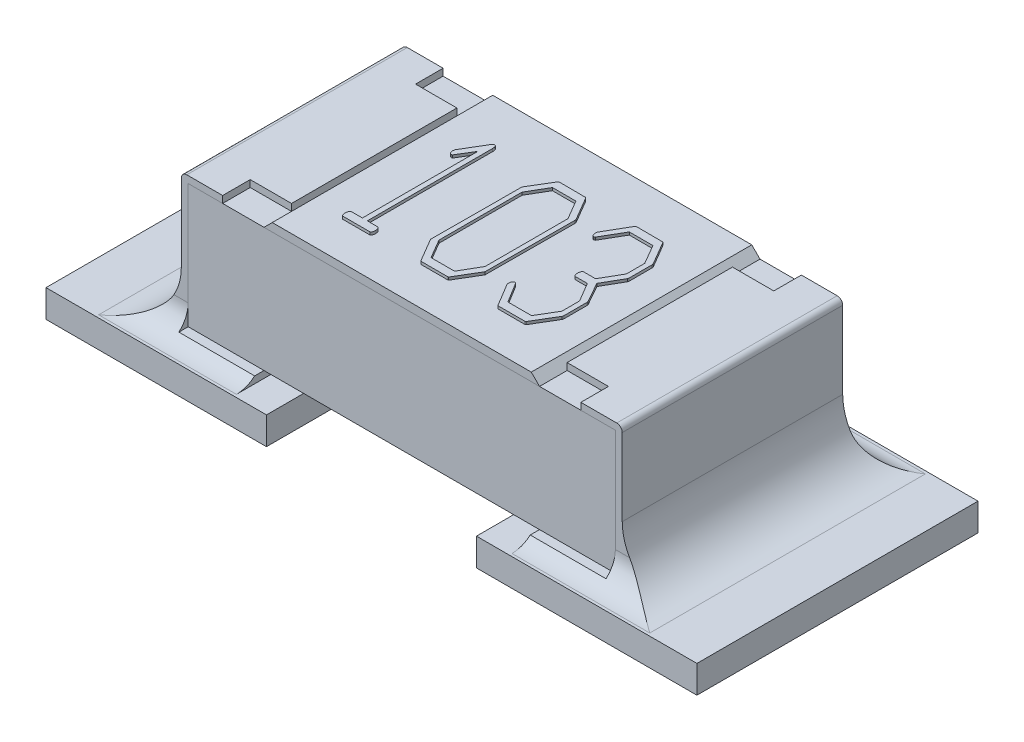
from build123d import *

# Parameters (mm, degrees)
SKETCH1_W             = 0.8
SKETCH1_H             = 0.45
BOSS_EXTRUDE1_DEPTH   = 0.775
BOSS_EXTRUDE2_DEPTH   = 0.4
BOSS_EXTRUDE2_2_DEPTH = 0.4
SKETCH3_W             = 0.15
SKETCH3_H             = 0.1
CUT_EXTRUDE1_DEPTH    = 0.025
BOSS_EXTRUDE3_DEPTH   = 0.4
BOSS_EXTRUDE4_DEPTH   = 0.01
SKETCH7_W             = 0.8
SKETCH7_H             = 1.02
BOSS_EXTRUDE5_DEPTH   = 0.1
FILLET3_R             = 0.2
FILLET4_R             = 0.2
FILLET5_R             = 0.1
FILLET6_R             = 0.1


with BuildPart() as part:
    # Sketch1 → Boss-Extrude1 (new, symmetric)
    with BuildSketch(Plane(origin=(0, 0, 0), x_dir=(0, 0, -1), z_dir=(1, 0, 0))):
        with Locations((0, 0.35)):
            Rectangle(SKETCH1_W, SKETCH1_H)
    extrude(amount=BOSS_EXTRUDE1_DEPTH, both=True)


with BuildPart() as body_2:
    # Sketch2 → Boss-Extrude2 (new, symmetric)
    with BuildSketch(Plane.XY):
        with BuildLine():
            Line((-0.5, 0.6), (-0.78, 0.6))
            ThreePointArc((-0.78, 0.6), (-0.794142136, 0.594142136), (-0.8, 0.58))
            Line((-0.8, 0.58), (-0.8, 0.1))
            Line((-0.8, 0.1), (-0.5, 0.1))
            Line((-0.5, 0.1), (-0.5, 0.125))
            Line((-0.5, 0.125), (-0.775, 0.125))
            Line((-0.775, 0.125), (-0.775, 0.575))
            Line((-0.775, 0.575), (-0.5, 0.575))
            Line((-0.5, 0.575), (-0.5, 0.6))
        make_face()
    extrude(amount=BOSS_EXTRUDE2_DEPTH, both=True)


with BuildPart() as body_3:
    # Sketch2 → Boss-Extrude2 2 (new, symmetric)
    with BuildSketch(Plane.XY):
        with BuildLine():
            Line((0.5, 0.575), (0.5, 0.6))
            Line((0.5, 0.6), (0.78, 0.6))
            ThreePointArc((0.78, 0.6), (0.794142136, 0.594142136), (0.8, 0.58))
            Line((0.8, 0.58), (0.8, 0.1))
            Line((0.8, 0.1), (0.5, 0.1))
            Line((0.5, 0.1), (0.5, 0.125))
            Line((0.5, 0.125), (0.775, 0.125))
            Line((0.775, 0.125), (0.775, 0.575))
            Line((0.775, 0.575), (0.5, 0.575))
        make_face()
    extrude(amount=BOSS_EXTRUDE2_2_DEPTH, both=True)


with BuildPart() as cut_extrude1_tool:
    # Sketch3 → Cut-Extrude1 (new body)
    with BuildSketch(Plane(origin=(0, 0.6, 0), x_dir=(1, 0, 0), z_dir=(0, 1, 0))):
        with Locations((-0.575, 0.35)):
            Rectangle(SKETCH3_W, SKETCH3_H)
        with Locations((-0.575, -0.35)):
            Rectangle(SKETCH3_W, SKETCH3_H)
        with Locations((0.575, -0.35)):
            Rectangle(SKETCH3_W, SKETCH3_H)
        with Locations((0.575, 0.35)):
            Rectangle(SKETCH3_W, SKETCH3_H)
    extrude(amount=-CUT_EXTRUDE1_DEPTH)


with BuildPart() as body_2_1:
    add(body_2.part)

    # Cut-Extrude1: cut by cut_extrude1_tool
    add(cut_extrude1_tool.part, mode=Mode.SUBTRACT)



with BuildPart() as body_3_1:
    add(body_3.part)

    # Cut-Extrude1: cut by cut_extrude1_tool
    add(cut_extrude1_tool.part, mode=Mode.SUBTRACT)


with BuildPart() as body_4:
    # Sketch4 → Boss-Extrude3 (new, symmetric)
    with BuildSketch(Plane.XY):
        Polygon((-0.5, 0.575), (0.5, 0.575), (0.47, 0.605), (-0.47, 0.605), align=None)
    extrude(amount=BOSS_EXTRUDE3_DEPTH, both=True)

    # Sketch6 → Boss-Extrude4 (add)
    # profile 1 of 3: a face of its own
    with BuildSketch(Plane(origin=(0, 0.605, 0), x_dir=(1, 0, 0), z_dir=(0, 1, 0))):
        with BuildLine():
            Line((-0.292857143, 0.221819196), (-0.292857143, -0.232142857))
            Line((-0.292857143, -0.232142857), (-0.253608631, -0.232142857))
            add(Edge.make_bspline(
                [(-0.253608631, -0.232142857), (-0.252514915, -0.233159523), (-0.250346122, -0.235175528), (-0.248921239, -0.239323698), (-0.247952001, -0.243100354), (-0.24781151, -0.245561302), (-0.247749256, -0.246651786)],
                knots=[0, 0, 0, 0, 1.094507773, 2.170363376, 3.18925981, 4, 4, 4, 4], degree=3))
            add(Edge.make_bspline(
                [(-0.247749256, -0.246651786), (-0.247790011, -0.24890061), (-0.247860511, -0.252790757), (-0.248927629, -0.257670974), (-0.250957131, -0.261266063), (-0.253164339, -0.261705298), (-0.254166667, -0.261904762)],
                knots=[0, 0, 0, 0, 1.483935822, 2.566997854, 3.349251094, 4, 4, 4, 4], degree=3))
            Line((-0.254166667, -0.261904762), (-0.352287946, -0.261904762))
            add(Edge.make_bspline(
                [(-0.352287946, -0.261904762), (-0.353191845, -0.261383497), (-0.355138277, -0.260261018), (-0.356845026, -0.256793507), (-0.357784968, -0.252323852), (-0.357898096, -0.248923727), (-0.35796131, -0.24702381)],
                knots=[0, 0, 0, 0, 0.731657516, 1.575533429, 2.645259425, 4, 4, 4, 4], degree=3))
            add(Edge.make_bspline(
                [(-0.35796131, -0.24702381), (-0.357847061, -0.245999991), (-0.357543408, -0.24327885), (-0.356855684, -0.239634421), (-0.355750939, -0.236384481), (-0.354715358, -0.234196716), (-0.35312544, -0.232808963), (-0.351931893, -0.232359173), (-0.351357887, -0.232142857)],
                knots=[0, 0, 0, 0, 1.077846596, 2.864738214, 3.859388994, 4.671949365, 5.361307703, 6, 6, 6, 6], degree=3))
            Line((-0.351357887, -0.232142857), (-0.310714286, -0.232142857))
            Line((-0.310714286, -0.232142857), (-0.310714286, 0.186476935))
            Line((-0.310714286, 0.186476935), (-0.345219494, 0.130208333))
            add(Edge.make_bspline(
                [(-0.345219494, 0.130208333), (-0.34594703, 0.129816395), (-0.34723663, 0.129121662), (-0.348681862, 0.128906863), (-0.349311756, 0.128813244)],
                knots=[0, 0, 0, 0, 1.128313794, 2, 2, 2, 2], degree=3))
            add(Edge.make_bspline(
                [(-0.349311756, 0.128813244), (-0.34994165, 0.128906863), (-0.351386882, 0.129121662), (-0.352676481, 0.129816395), (-0.353404018, 0.130208333)],
                knots=[0, 0, 0, 0, 0.871686206, 2, 2, 2, 2], degree=3))
            add(Edge.make_bspline(
                [(-0.353404018, 0.130208333), (-0.354762035, 0.132029405), (-0.357658077, 0.135912935), (-0.35809911, 0.140752164), (-0.358333333, 0.143322173)],
                knots=[0, 0, 0, 0, 0.937843913, 2, 2, 2, 2], degree=3))
            Line((-0.358333333, 0.143322173), (-0.357124256, 0.150297619))
            Line((-0.357124256, 0.150297619), (-0.306901042, 0.234654018))
            add(Edge.make_bspline(
                [(-0.306901042, 0.234654018), (-0.306052725, 0.23565958), (-0.304616067, 0.23736254), (-0.302476074, 0.237882361), (-0.301599702, 0.238095238)],
                knots=[0, 0, 0, 0, 1.180958283, 2, 2, 2, 2], degree=3))
            add(Edge.make_bspline(
                [(-0.301599702, 0.238095238), (-0.300254548, 0.237901979), (-0.297496165, 0.23750568), (-0.29448599, 0.233775342), (-0.293094631, 0.228376002), (-0.292944039, 0.224218313), (-0.292857143, 0.221819196)],
                knots=[0, 0, 0, 0, 0.76869288, 1.576286457, 2.601441333, 4, 4, 4, 4], degree=3))
        make_face()
    # profile 2 of 3: a face of its own
    with BuildSketch(Plane(origin=(0, 0.605, 0), x_dir=(1, 0, 0), z_dir=(0, 1, 0))):
        Polygon((0.032849702, 0.234002976), (0.081305804, 0.151227679), (0.082142857, 0.145182292), (0.080561756, -0.178478423), (0.031268601, -0.26125372), (0.027269345, -0.261904762), (-0.068526786, -0.261904762), (-0.07094494, -0.259207589), (-0.119866071, -0.17578125), (-0.120238095, -0.168991815), (-0.118656994, 0.154668899), (-0.069363839, 0.236700149), (-0.066945685, 0.238095238), (0.030059524, 0.237444196), align=None)
        Polygon((0.064285714, 0.138764881), (0.023549107, 0.208333333), (-0.061644345, 0.208333333), (-0.102380952, 0.138764881), (-0.102380952, -0.162574405), (-0.061644345, -0.232142857), (0.023549107, -0.232142857), (0.064285714, -0.161923363), align=None, mode=Mode.SUBTRACT)
    # profile 3 of 3: a face of its own
    with BuildSketch(Plane(origin=(0, 0.605, 0), x_dir=(1, 0, 0), z_dir=(0, 1, 0))):
        with BuildLine():
            Line((0.312611607, 0.234002976), (0.361067708, 0.151227679))
            Line((0.361067708, 0.151227679), (0.361904762, 0.145182292))
            Line((0.361904762, 0.145182292), (0.361904762, 0.063058036))
            Line((0.361904762, 0.063058036), (0.360695685, 0.058314732))
            Line((0.360695685, 0.058314732), (0.320145089, -0.012276786))
            Line((0.320145089, -0.012276786), (0.360695685, -0.084170387))
            Line((0.360695685, -0.084170387), (0.361904762, -0.08891369))
            Line((0.361904762, -0.08891369), (0.361904762, -0.172991071))
            Line((0.361904762, -0.172991071), (0.360695685, -0.178478423))
            Line((0.360695685, -0.178478423), (0.311309524, -0.26125372))
            Line((0.311309524, -0.26125372), (0.307310268, -0.261904762))
            Line((0.307310268, -0.261904762), (0.211328125, -0.261904762))
            Line((0.211328125, -0.261904762), (0.20890997, -0.259207589))
            Line((0.20890997, -0.259207589), (0.159895833, -0.177548363))
            add(Edge.make_bspline(
                [(0.159895833, -0.177548363), (0.159788443, -0.176681244), (0.159517027, -0.174489697), (0.159521255, -0.17228021), (0.15952381, -0.17094494)],
                knots=[0, 0, 0, 0, 0.791330927, 2, 2, 2, 2], degree=3))
            add(Edge.make_bspline(
                [(0.15952381, -0.17094494), (0.159518098, -0.169980402), (0.159508843, -0.168417682), (0.159788707, -0.166882343), (0.159895833, -0.166294643)],
                knots=[0, 0, 0, 0, 1.234435563, 2, 2, 2, 2], degree=3))
            add(Edge.make_bspline(
                [(0.159895833, -0.166294643), (0.160226067, -0.165050815), (0.160834803, -0.162758001), (0.162727701, -0.160041395), (0.164776814, -0.157801232), (0.166610492, -0.157262127), (0.167522321, -0.156994048)],
                knots=[0, 0, 0, 0, 1.206652828, 2.224285909, 3.116994777, 4, 4, 4, 4], degree=3))
            add(Edge.make_bspline(
                [(0.167522321, -0.156994048), (0.168857155, -0.15729556), (0.171874372, -0.157977088), (0.173439211, -0.160689792), (0.174311756, -0.162202381)],
                knots=[0, 0, 0, 0, 0.884811277, 2, 2, 2, 2], degree=3))
            Line((0.174311756, -0.162202381), (0.217280506, -0.232142857))
            Line((0.217280506, -0.232142857), (0.303031994, -0.232142857))
            Line((0.303031994, -0.232142857), (0.344047619, -0.16313244))
            Line((0.344047619, -0.16313244), (0.344047619, -0.098772321))
            Line((0.344047619, -0.098772321), (0.303125, -0.029761905))
            Line((0.303125, -0.029761905), (0.259133185, -0.029761905))
            add(Edge.make_bspline(
                [(0.259133185, -0.029761905), (0.258135587, -0.029049571), (0.256073308, -0.027577), (0.254139898, -0.023897974), (0.252943859, -0.019363369), (0.252856327, -0.015976601), (0.25280878, -0.014136905)],
                knots=[0, 0, 0, 0, 0.823895179, 1.703194927, 2.752372739, 4, 4, 4, 4], degree=3))
            add(Edge.make_bspline(
                [(0.25280878, -0.014136905), (0.252931841, -0.012090481), (0.25316971, -0.008134877), (0.254808158, -0.004530053), (0.255598958, -0.002790179)],
                knots=[0, 0, 0, 0, 1.034696418, 2, 2, 2, 2], degree=3))
            add(Edge.make_bspline(
                [(0.255598958, -0.002790179), (0.256412363, -0.001956226), (0.258203731, -0.000119606), (0.260790295, -4.2238e-05), (0.262202381, 0)],
                knots=[0, 0, 0, 0, 0.908138185, 2, 2, 2, 2], degree=3))
            Line((0.262202381, 0), (0.303125, 0))
            Line((0.303125, 0), (0.344047619, 0.07077753))
            Line((0.344047619, 0.07077753), (0.344047619, 0.137555804))
            Line((0.344047619, 0.137555804), (0.303031994, 0.208333333))
            Line((0.303031994, 0.208333333), (0.217280506, 0.208333333))
            Line((0.217280506, 0.208333333), (0.171893601, 0.130208333))
            add(Edge.make_bspline(
                [(0.171893601, 0.130208333), (0.171165939, 0.129817639), (0.169903116, 0.129139609), (0.168492246, 0.128910385), (0.167894345, 0.128813244)],
                knots=[0, 0, 0, 0, 1.152437574, 2, 2, 2, 2], degree=3))
            add(Edge.make_bspline(
                [(0.167894345, 0.128813244), (0.166715898, 0.129002619), (0.16419856, 0.129407153), (0.161400816, 0.132865271), (0.159681434, 0.137855724), (0.159581059, 0.14181055), (0.15952381, 0.14406622)],
                knots=[0, 0, 0, 0, 0.723786097, 1.5461138, 2.600403721, 4, 4, 4, 4], degree=3))
            Line((0.15952381, 0.14406622), (0.160360863, 0.150297619))
            Line((0.160360863, 0.150297619), (0.209654018, 0.23530506))
            Line((0.209654018, 0.23530506), (0.21281622, 0.238095238))
            Line((0.21281622, 0.238095238), (0.309821429, 0.237444196))
            Line((0.309821429, 0.237444196), (0.312611607, 0.234002976))
        make_face()
    extrude(amount=BOSS_EXTRUDE4_DEPTH)


with BuildPart() as body_2_2:
    add(body_2_1.part)

    add(body_3_1.part)  # Boss-Extrude5 merges body 3
    # Sketch7 → Boss-Extrude5 (add)
    with BuildSketch(Plane(origin=(0, 0, 0), x_dir=(1, 0, 0), z_dir=(0, 1, 0))):
        with Locations((-0.781, 0)):
            Rectangle(SKETCH7_W, SKETCH7_H)
        with Locations((0.781, 0)):
            Rectangle(SKETCH7_W, SKETCH7_H)
    extrude(amount=BOSS_EXTRUDE5_DEPTH)

    # Fillet3
    fillet3_edges = [body_2_2.edges().sort_by_distance(p)[0] for p in [
        (-0.8, 0.1, 0),
    ]]
    fillet(fillet3_edges, radius=FILLET3_R)

    # Fillet4
    fillet4_edges = [body_2_2.edges().sort_by_distance(p)[0] for p in [
        (0.8, 0.1, 0),
    ]]
    fillet(fillet4_edges, radius=FILLET4_R)

    # Fillet5
    fillet5_edges = [body_2_2.edges().sort_by_distance(p)[0] for p in [
        (0.75, 0.1, 0.4),
    ]]
    fillet(fillet5_edges, radius=FILLET5_R)
    fillet5_2_edges = [body_2_2.edges().sort_by_distance(p)[0] for p in [
        (0.75, 0.1, -0.4),
    ]]
    fillet(fillet5_2_edges, radius=FILLET5_R)

    # Fillet6
    fillet6_edges = [body_2_2.edges().sort_by_distance(p)[0] for p in [
        (-0.75, 0.1, -0.4),
    ]]
    fillet(fillet6_edges, radius=FILLET6_R)
    fillet6_2_edges = [body_2_2.edges().sort_by_distance(p)[0] for p in [
        (-0.75, 0.1, 0.4),
    ]]
    fillet(fillet6_2_edges, radius=FILLET6_R)


solid = Compound([part.part, body_4.part, body_2_2.part])
